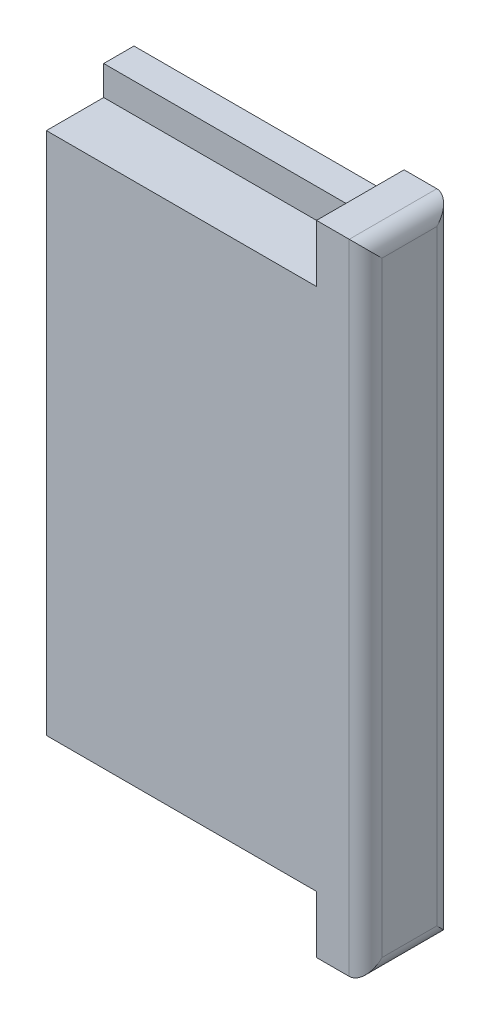
from build123d import *

# Parameters (mm, degrees)
SKETCH1_W   = 16.5
SKETCH1_H   = 35.6
INT_2_DEPTH = 1.85
SKETCH2_W   = 16.5
SKETCH2_H   = 32
EXT_DEPTH   = 3.5
SKETCH3_W   = 5.35
SKETCH3_H   = 39
TOP_DEPTH   = 3
FILLET1_R   = 1


with BuildPart() as part:
    # Sketch1 → Int 2 (new body)
    with BuildSketch(Plane.XY):
        Rectangle(SKETCH1_W, SKETCH1_H)
    extrude(amount=INT_2_DEPTH)

    # Sketch2 → Ext (add)
    with BuildSketch(Plane.XY.offset(1.85)):
        Rectangle(SKETCH2_W, SKETCH2_H)
    extrude(amount=EXT_DEPTH)

    # Sketch3 → Top (add)
    with BuildSketch(Plane(origin=(8.25, 0, 0), x_dir=(0, 0, -1), z_dir=(1, 0, 0))):
        with Locations((-2.675, 0)):
            Rectangle(SKETCH3_W, SKETCH3_H)
    extrude(amount=TOP_DEPTH)

    # Fillet1
    fillet1_edges = [part.edges().sort_by_distance(p)[0] for p in [
        (11.25, -19.5, 2.675),
        (11.25, 0, 5.35),
        (11.25, 19.5, 2.675),
        (11.25, 0, 0),
    ]]
    fillet(fillet1_edges, radius=FILLET1_R)


solid = part.part
